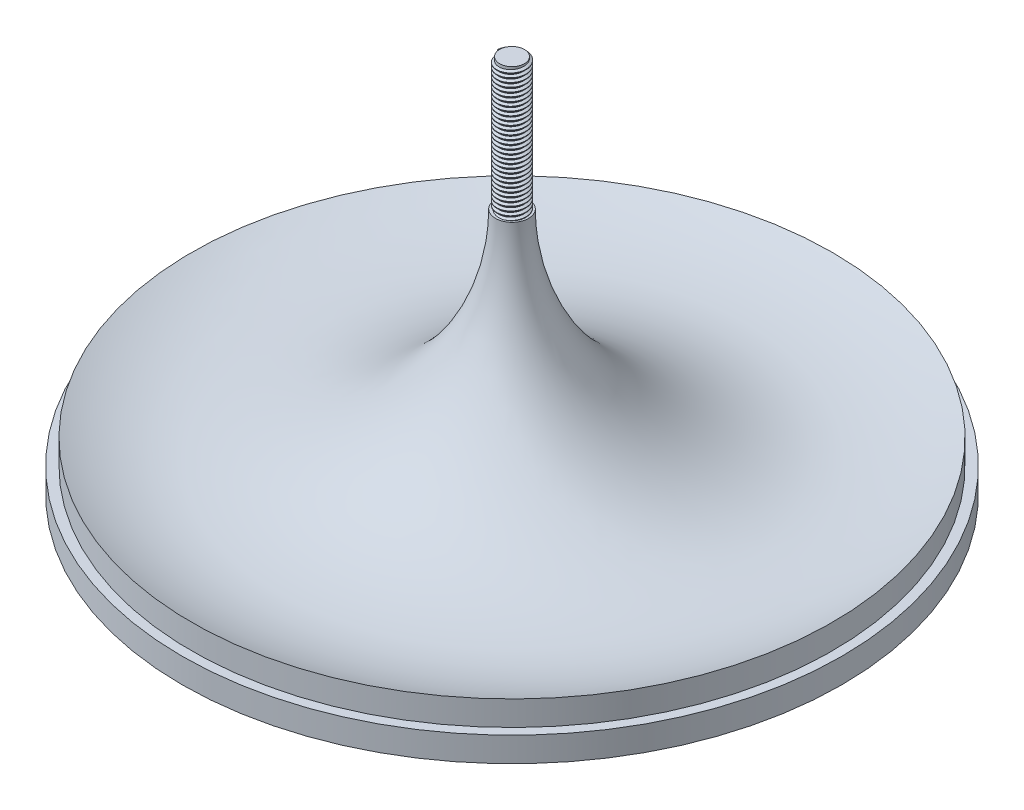
from build123d import *

# Parameters (mm, degrees)
SKETCH3_R           = 0.75
BOSS_EXTRUDE1_DEPTH = 8
THREAD1_PITCH       = 0.25


with BuildPart() as part:
    # Sketch2 → Revolve1 (revolve)
    with BuildSketch(Plane.XY, mode=Mode.PRIVATE) as revolve1_sk:
        with BuildLine():
            Line((0, 0), (15, 0))
            Line((15, 0), (20, 0))
            Line((20, 0), (20, 1.5))
            Line((20, 1.5), (19.430729379, 1.5))
            Line((19.430729379, 1.5), (19.430729379, 3))
            ThreePointArc((19.430729379, 3), (6.962212695, 4.003502996), (1, 15))
            Line((1, 15), (0, 15))
            Line((0, 15), (0, 0))
        make_face()
    revolve(revolve1_sk.sketch.rotate(Axis((0, 0, 0), (0, 1, 0)), 90), axis=Axis((0, 0, 0), (0, 1, 0)))

    # Sketch3 → Boss-Extrude1 (add)
    with BuildSketch(Plane(origin=(0, 15, 0), x_dir=(1, 0, 0), z_dir=(0, 1, 0))):
        with Locations(Location((0, 0, 0), (0, 0, 270))):
            Circle(SKETCH3_R)
    extrude(amount=BOSS_EXTRUDE1_DEPTH)

    # Thread1: the profile of Thread Profile1 profile screwed along a right-hand helix of 32 turns, 6 arcs to a turn; built about Z, then put on its axis
    thread1_z = Axis((0, 0, 0), (0, 0, 1))
    thread1_corners = [(0.7497, 0, -0.000173205), (0.885316469, 0, 0.078125), (0.885316469, 0, 0.109375), (0.7497, 0, 0.187673204)]
    with BuildLine(mode=Mode.PRIVATE) as thread1_profile:
        Line(thread1_corners[0], thread1_corners[1])
        Line(thread1_corners[1], thread1_corners[2])
        Line(thread1_corners[2], thread1_corners[3])
        Line(thread1_corners[3], thread1_corners[0])
    thread1_cap = Face(thread1_profile.wire())
    thread1_turn_angles = [0, 30, 60, 90, 120, 150, 180, 210, 240, 270, 300, 330, 360]
    thread1_turn_weights = [1, 0.8660254037844387, 1, 0.8660254037844387, 1, 0.8660254037844387, 1, 0.8660254037844387, 1, 0.8660254037844387, 1, 0.8660254037844387, 1]
    thread1_turn_rails = [Edge.make_bspline([Vector(p[0], p[1], 0).rotate(thread1_z, thread1_turn_angles[k]) / thread1_turn_weights[k] + Vector(0, 0, p[2] + THREAD1_PITCH * thread1_turn_angles[k] / 360) for k in range(13)], [0, 0, 0, 1, 1, 2, 2, 3, 3, 4, 4, 5, 5, 6, 6, 6], 2, thread1_turn_weights) for p in thread1_corners]
    thread1_turn_sides = [Face.make_surface_from_curves(thread1_turn_rails[p[0]], thread1_turn_rails[p[1]]) for p in [(0, 1), (1, 2), (2, 3), (3, 0)]]
    thread1 = Plane(origin=(0, 23, 0), x_dir=(-1, 0, 0), z_dir=(0, -1, 0)) * Solid(Shell([*[p.moved(Location((0, 0, THREAD1_PITCH * i))) for i in range(32) for p in thread1_turn_sides], thread1_cap, thread1_cap.rotate(thread1_z, 11520).moved(Location((0, 0, THREAD1_PITCH * 11520 / 360)))]))
    add(thread1)


solid = part.part
